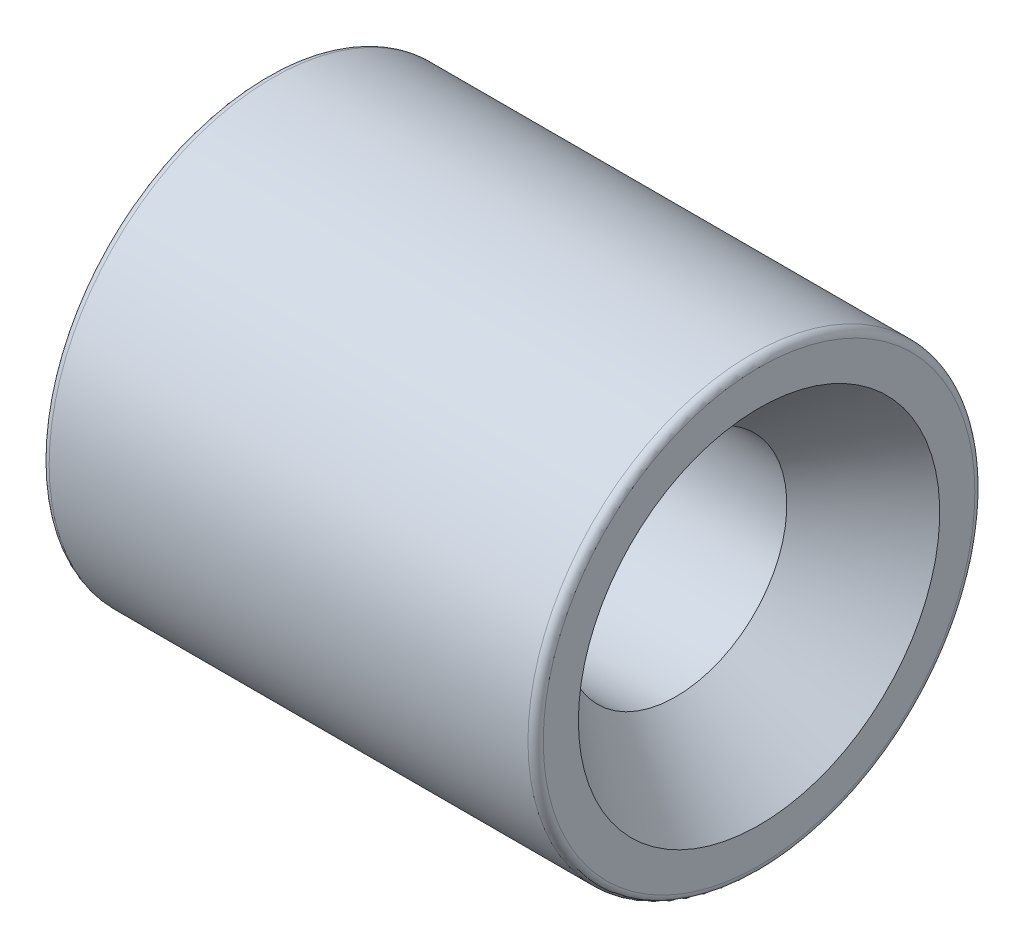
from build123d import *


with BuildPart() as part:
    # Sketch1 → Revolve1 (revolve)
    with BuildSketch(Plane.XY):
        with BuildLine():
            Line((0, 0), (-51.354488934, 0))
            Line((-51.354488934, 0), (-64.377244467, 10.927389365))
            Line((-64.377244467, 10.927389365), (-64.377244467, 16.427389365))
            ThreePointArc((-64.377244467, 16.427389365), (-64.025772604, 17.275917502), (-63.177244467, 17.627389365))
            Line((-63.177244467, 17.627389365), (11.822755533, 17.627389365))
            ThreePointArc((11.822755533, 17.627389365), (12.67128367, 17.275917502), (13.022755533, 16.427389365))
            Line((13.022755533, 16.427389365), (13.022755533, 10.927389365))
            Line((13.022755533, 10.927389365), (0, 0))
        make_face()
    revolve(axis=Axis((-93.785874107, -17.372610635, 0), (1, 0, 0)))


solid = part.part
